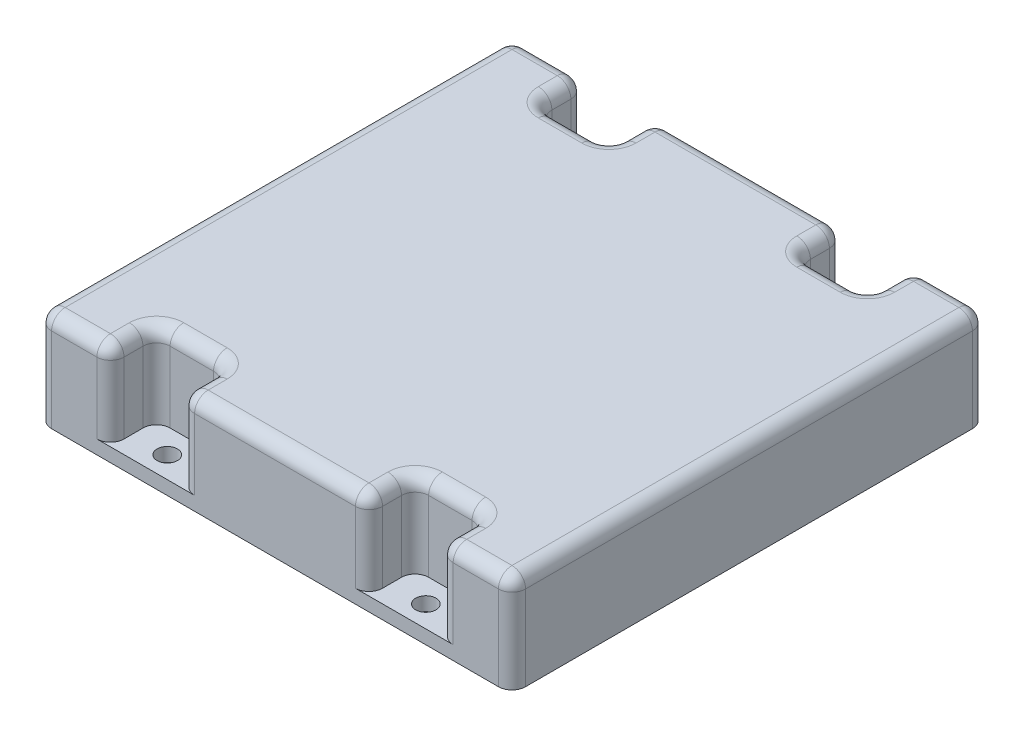
from build123d import *

# Parameters (mm, degrees)
SKETCH1_W                    = 139.7
SKETCH1_H                    = 139.7
BOSS_EXTRUDE1_DEPTH          = 4.064
BOSS_EXTRUDE2_DEPTH          = 24.892
FILLET1_R                    = 4
FILLET2_R                    = 4
F_6_0_6_DIAMETER_HOLE1_D     = 6
F_6_0_6_DIAMETER_HOLE1_DEPTH = 18.75
F_6_0_6_DIAMETER_HOLE1_TIP   = 1.802581857


with BuildPart() as part:
    # Sketch1 → Boss-Extrude1 (new body)
    with BuildSketch(Plane(origin=(0, 0, 0), x_dir=(1, 0, 0), z_dir=(0, 1, 0))):
        Rectangle(SKETCH1_W, SKETCH1_H)
    extrude(amount=BOSS_EXTRUDE1_DEPTH)

    # Sketch2 → Boss-Extrude2 (add)
    with BuildSketch(Plane(origin=(0, 4.064, 0), x_dir=(1, 0, 0), z_dir=(0, 1, 0))):
        Polygon((27.6987, 69.85), (-27.6987, 69.85), (-27.6987, 56.261), (-48.5013, 56.261), (-48.5013, 69.85), (-69.85, 69.85), (-69.85, -69.85), (-48.5013, -69.85), (-48.5013, -56.261), (-27.6987, -56.261), (-27.6987, -69.85), (27.6987, -69.85), (27.6987, -56.261), (48.5013, -56.261), (48.5013, -69.85), (69.85, -69.85), (69.85, 69.85), (48.5013, 69.85), (48.5013, 56.261), (27.6987, 56.261), align=None)
    extrude(amount=BOSS_EXTRUDE2_DEPTH)

    # Fillet1
    fillet1_edges = [part.edges().sort_by_distance(p)[0] for p in [
        (69.85, 14.478, -69.85),
        (48.5013, 16.51, -69.85),
        (48.5013, 16.51, -56.261),
        (27.6987, 16.51, -56.261),
        (27.6987, 16.51, -69.85),
        (-27.6987, 16.51, -69.85),
        (-27.6987, 16.51, -56.261),
        (-48.5013, 16.51, -56.261),
        (-48.5013, 16.51, -69.85),
        (-69.85, 14.478, -69.85),
        (-69.85, 14.478, 69.85),
        (-48.5013, 16.51, 69.85),
        (-48.5013, 16.51, 56.261),
        (-27.6987, 16.51, 56.261),
        (-27.6987, 16.51, 69.85),
        (48.5013, 16.51, 69.85),
        (48.5013, 16.51, 56.261),
        (27.6987, 16.51, 56.261),
        (27.6987, 16.51, 69.85),
        (69.85, 14.478, 69.85),
    ]]
    fillet(fillet1_edges, radius=FILLET1_R)

    # Fillet2
    fillet2_edges = [part.edges().sort_by_distance(p)[0] for p in [
        (-68.678427125, 28.956, -68.678427125),
        (-59.17565, 28.956, -69.85),
        (-49.672872875, 28.956, -68.678427125),
        (-48.5013, 28.956, -63.0555),
        (-47.329727125, 28.956, -57.432572875),
        (-38.1, 28.956, -56.261),
        (-28.870272875, 28.956, -57.432572875),
        (-27.6987, 28.956, -63.0555),
        (-26.527127125, 28.956, -68.678427125),
        (0, 28.956, -69.85),
        (26.527127125, 28.956, -68.678427125),
        (27.6987, 28.956, -63.0555),
        (28.870272875, 28.956, -57.432572875),
        (38.1, 28.956, -56.261),
        (47.329727125, 28.956, -57.432572875),
        (48.5013, 28.956, -63.0555),
        (49.672872875, 28.956, -68.678427125),
        (59.17565, 28.956, -69.85),
        (68.678427125, 28.956, -68.678427125),
        (69.85, 28.956, 0),
        (68.678427125, 28.956, 68.678427125),
        (59.17565, 28.956, 69.85),
        (49.672872875, 28.956, 68.678427125),
        (48.5013, 28.956, 63.0555),
        (47.329727125, 28.956, 57.432572875),
        (38.1, 28.956, 56.261),
        (28.870272875, 28.956, 57.432572875),
        (27.6987, 28.956, 63.0555),
        (26.527127125, 28.956, 68.678427125),
        (0, 28.956, 69.85),
        (-26.527127125, 28.956, 68.678427125),
        (-27.6987, 28.956, 63.0555),
        (-28.870272875, 28.956, 57.432572875),
        (-38.1, 28.956, 56.261),
        (-47.329727125, 28.956, 57.432572875),
        (-48.5013, 28.956, 63.0555),
        (-49.672872875, 28.956, 68.678427125),
        (-59.17565, 28.956, 69.85),
        (-68.678427125, 28.956, 68.678427125),
        (-69.85, 28.956, 0),
    ]]
    fillet(fillet2_edges, radius=FILLET2_R)

    # Ø6.0 (6) Diameter Hole1
    with Locations(Plane(origin=(0, 4.064, 0), x_dir=(1, 0, 0), z_dir=(0, 1, 0))):
        with Locations((-38.1, 63.5), (38.1, 63.5), (38.1, -63.5), (-38.1, -63.5)):
            Hole(F_6_0_6_DIAMETER_HOLE1_D / 2, depth=F_6_0_6_DIAMETER_HOLE1_DEPTH)
            with Locations((0, 0, -(F_6_0_6_DIAMETER_HOLE1_DEPTH + F_6_0_6_DIAMETER_HOLE1_TIP / 2))):  # 118° drill point
                Cone(0, F_6_0_6_DIAMETER_HOLE1_D / 2, F_6_0_6_DIAMETER_HOLE1_TIP, mode=Mode.SUBTRACT)


solid = part.part
